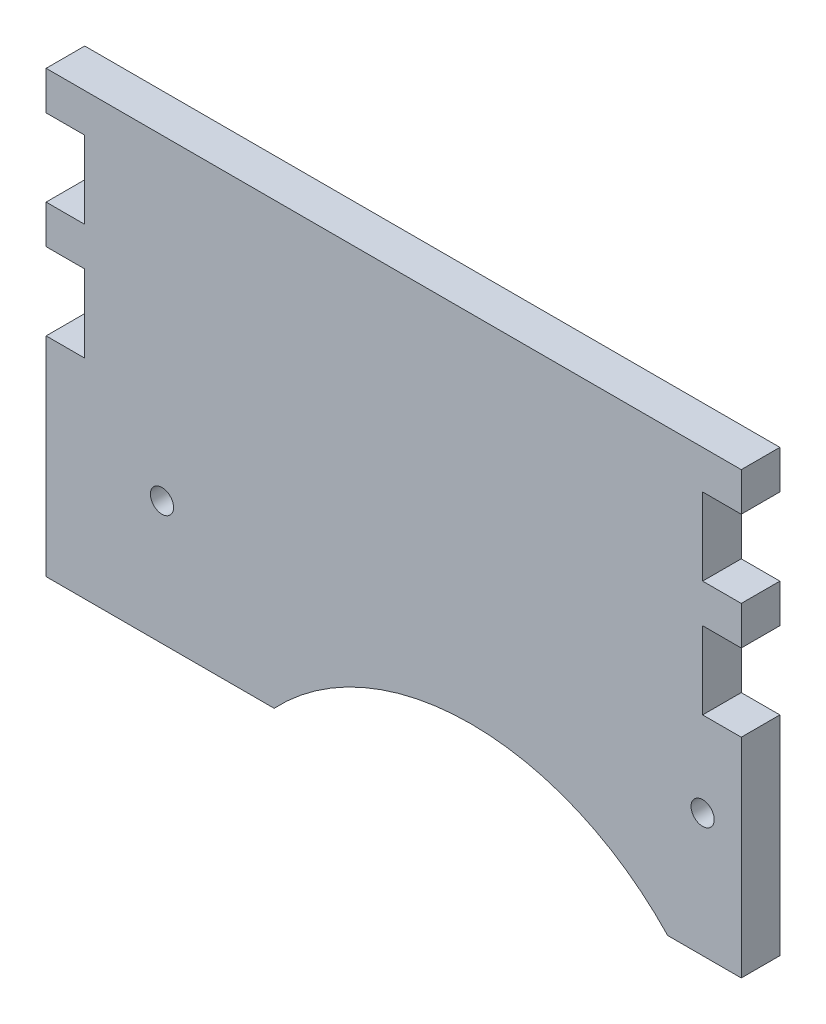
from build123d import *

# Parameters (mm, degrees)
ESQUISSE1_R        = 1.5
BOSS_EXTRU_1_DEPTH = 5


with BuildPart() as part:
    # Esquisse1 → Boss.-Extru.1 (new body)
    with BuildSketch(Plane.XY):
        with BuildLine():
            Line((0, 27), (0, 0))
            Line((0, 0), (29.524521594, 0))
            ThreePointArc((29.524521594, 0), (55, 11), (80.475478406, 0))
            Line((80.475478406, 0), (90, 0))
            Line((90, 0), (90, 27))
            Line((90, 27), (85, 27))
            Line((85, 27), (85, 37))
            Line((85, 37), (90, 37))
            Line((90, 37), (90, 42))
            Line((90, 42), (85, 42))
            Line((85, 42), (85, 52))
            Line((85, 52), (90, 52))
            Line((90, 52), (90, 57))
            Line((90, 57), (0, 57))
            Line((0, 57), (0, 52))
            Line((0, 52), (5, 52))
            Line((5, 52), (5, 42))
            Line((5, 42), (0, 42))
            Line((0, 42), (0, 37))
            Line((0, 37), (5, 37))
            Line((5, 37), (5, 27))
            Line((5, 27), (0, 27))
        make_face()
        with Locations((15, 16)):
            Circle(ESQUISSE1_R, mode=Mode.SUBTRACT)
        with Locations((85, 16)):
            Circle(ESQUISSE1_R, mode=Mode.SUBTRACT)
    extrude(amount=BOSS_EXTRU_1_DEPTH)


solid = part.part
